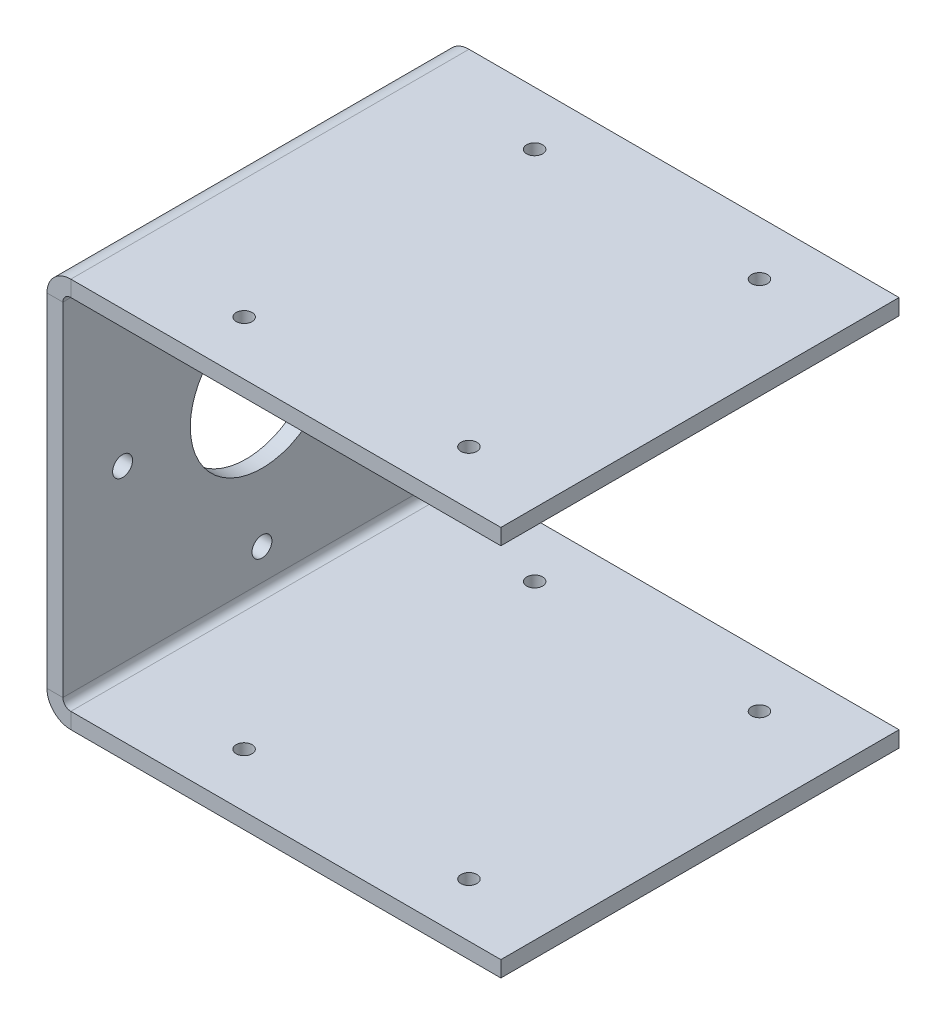
from build123d import *

# Parameters (mm, degrees)
BASE_FLANGE3_DEPTH        = 100
SKETCH16_R                = 18
CUT_EXTRUDE1_DEPTH        = 10
F_4_0MM_DOWEL_HOLE1_D     = 4
F_5_0MM_DOWEL_HOLE1_D     = 5
F_5_0MM_DOWEL_HOLE1_DEPTH = 98.31
F_5_0MM_DOWEL_HOLE1_TIP   = 1.502151548


# Sheet-metal steps are written as plain solids
with BuildPart() as part:
    # Sketch1 → Base-Flange3 (new body)
    with BuildSketch(Plane.XY):
        with BuildLine():
            Line((110, 0), (2, 0))
            ThreePointArc((2, 0), (0.585786438, -0.585786438), (0, -2))
            Line((0, -2), (0, -88))
            ThreePointArc((0, -88), (0.585786438, -89.414213562), (2, -90))
            Line((2, -90), (110, -90))
            Line((110, -90), (110, -94))
            Line((110, -94), (2, -94))
            ThreePointArc((2, -94), (-2.242640687, -92.242640687), (-4, -88))
            Line((-4, -88), (-4, -2))
            ThreePointArc((-4, -2), (-2.242640687, 2.242640687), (2, 4))
            Line((2, 4), (110, 4))
            Line((110, 4), (110, 0))
        make_face()
    extrude(amount=BASE_FLANGE3_DEPTH)

    # Sketch16 → Cut-Extrude1 (cut)
    with BuildSketch(Plane.ZY.offset(4)):
        with Locations((50, -45.153641777)):
            Circle(SKETCH16_R)
    extrude(amount=-CUT_EXTRUDE1_DEPTH, mode=Mode.SUBTRACT)

    # Ø4.0mm Dowel Hole1 (through all)
    with Locations(Plane(origin=(0, -94, 0), x_dir=(-1, 0, 0), z_dir=(0, -1, 0))):
        with Locations((-32, -86.483109463), (-32, -13.516890537), (-88.463106056, -86.483109463), (-88.463106056, -13.516890537)):
            Hole(F_4_0MM_DOWEL_HOLE1_D / 2)

    # Ø5.0mm Dowel Hole1
    with Locations(Plane.ZY.offset(4)):
        with Locations((50, -10.153641777), (85, -45.153641777), (50, -80.153641777), (15, -45.153641777)):
            Hole(F_5_0MM_DOWEL_HOLE1_D / 2, depth=F_5_0MM_DOWEL_HOLE1_DEPTH)
            with Locations((0, 0, -(F_5_0MM_DOWEL_HOLE1_DEPTH + F_5_0MM_DOWEL_HOLE1_TIP / 2))):  # 118° drill point
                Cone(0, F_5_0MM_DOWEL_HOLE1_D / 2, F_5_0MM_DOWEL_HOLE1_TIP, mode=Mode.SUBTRACT)


solid = part.part
